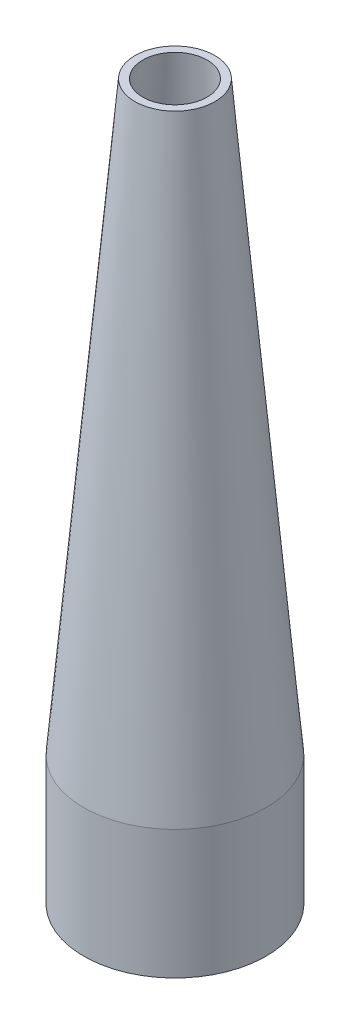
from build123d import *


with BuildPart() as part:
    # Sketch1 → Revolve1 (revolve)
    with BuildSketch(Plane.XY):
        Polygon((11.819732149, 53.534936378), (9.525, 53.534936378), (24.692767851, -119.83344348), (24.692767851, -157.93344348), (26.9875, -157.93344348), (26.9875, -119.83344348), align=None)
    revolve(axis=Axis((0, 0, 0), (0, 1, 0)))


solid = part.part
